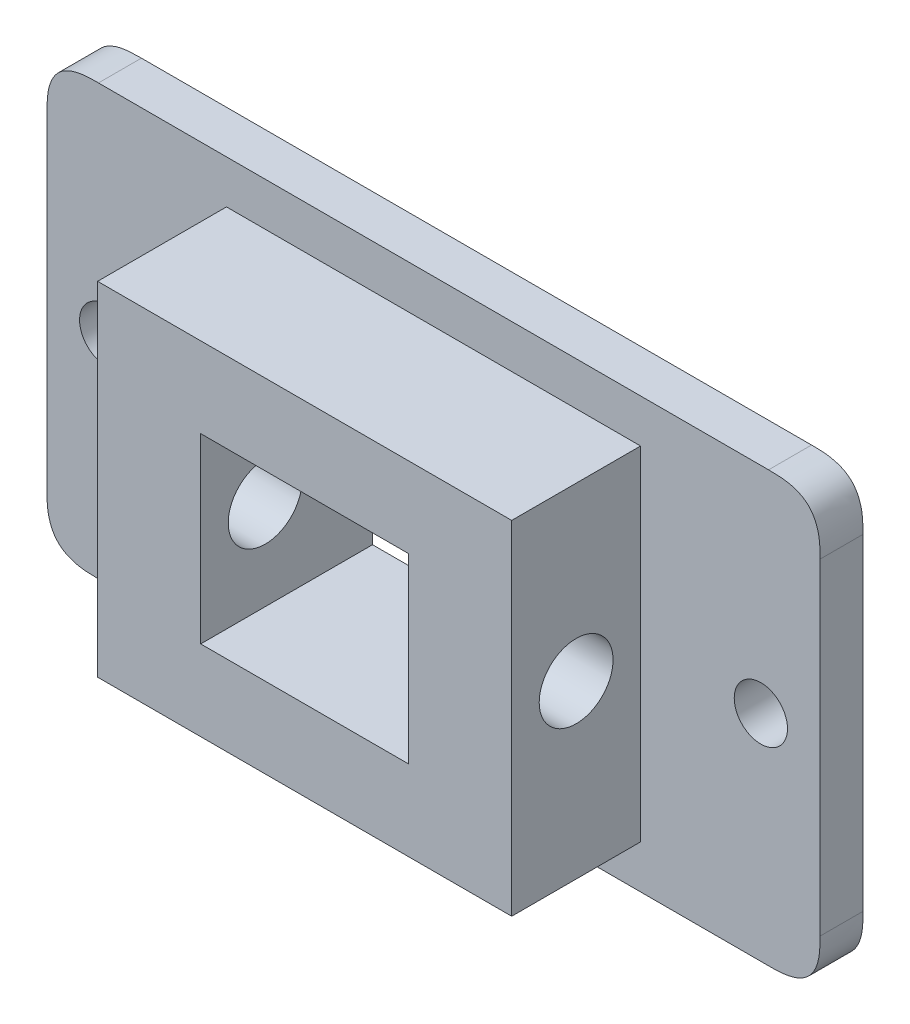
from build123d import *

# Parameters (mm, degrees)
SKETCH1_W           = 45
SKETCH1_H           = 25
SKETCH1_W_2         = 12.1
SKETCH1_H_2         = 10.6
BOSS_EXTRUDE1_DEPTH = 2.5
SKETCH2_W           = 12.1
SKETCH2_H           = 7.2
BOSS_EXTRUDE2_DEPTH = 7.5
BOSS_EXTRUDE3_START = 6.05
SKETCH3_W           = 7.5
SKETCH3_H           = 25
SKETCH3_R           = 2.15
BOSS_EXTRUDE3_DEPTH = 6
BOSS_EXTRUDE4_START = -14.05
SKETCH3_2_W         = 7.5
SKETCH3_2_H         = 25
SKETCH3_2_R         = 2.15
BOSS_EXTRUDE4_DEPTH = 8
SKETCH5_R           = 1.55
CUT_EXTRUDE1_DEPTH  = 10
FILLET1_SIZE        = 3
SKETCH6_OUTSIDE_W   = 57.488
SKETCH6_OUTSIDE_H   = 37.488
SKETCH6_OUTSIDE_W_2 = 24.1
SKETCH6_OUTSIDE_H_2 = 19.953815678
CUT_EXTRUDE2_DEPTH  = 7.5


with BuildPart() as part:
    # Sketch1 → Boss-Extrude1 (new body)
    with BuildSketch(Plane.XY):
        Rectangle(SKETCH1_W, SKETCH1_H)
        Rectangle(SKETCH1_W_2, SKETCH1_H_2, mode=Mode.SUBTRACT)
    extrude(amount=BOSS_EXTRUDE1_DEPTH)

    # Sketch2 → Boss-Extrude2 (add)
    with BuildSketch(Plane.XY.offset(2.5)):
        with Locations((0, -8.9)):
            Rectangle(SKETCH2_W, SKETCH2_H)
        with Locations((0, 8.9)):
            Rectangle(SKETCH2_W, SKETCH2_H)
    extrude(amount=BOSS_EXTRUDE2_DEPTH)

    # Sketch3 → Boss-Extrude3 (add)
    with BuildSketch(Plane(origin=(0, 0, 0), x_dir=(0, 0, -1), z_dir=(1, 0, 0)).offset(BOSS_EXTRUDE3_START)):
        with Locations((-6.25, 0)):
            Rectangle(SKETCH3_W, SKETCH3_H)
        with Locations(Location((-6.25, 0, 0), (0, 0, 180))):
            Circle(SKETCH3_R, mode=Mode.SUBTRACT)
    extrude(amount=BOSS_EXTRUDE3_DEPTH)

    # Sketch3<2> → Boss-Extrude4 (add)
    with BuildSketch(Plane(origin=(0, 0, 0), x_dir=(0, 0, -1), z_dir=(1, 0, 0)).offset(BOSS_EXTRUDE4_START)):
        with Locations((-6.25, 0)):
            Rectangle(SKETCH3_2_W, SKETCH3_2_H)
        with Locations(Location((-6.25, 0, 0), (0, 0, 180))):
            Circle(SKETCH3_2_R, mode=Mode.SUBTRACT)
    extrude(amount=BOSS_EXTRUDE4_DEPTH)

    # Sketch5 → Cut-Extrude1 (cut)
    with BuildSketch(Plane(origin=(0, 0, 0), x_dir=(-1, 0, 0), z_dir=(0, 0, -1))):
        with Locations((-19.05, 0)):
            Circle(SKETCH5_R)
        with Locations(Location((19.05, 0, 0), (0, 0, 180))):
            Circle(SKETCH5_R)
    extrude(amount=-CUT_EXTRUDE1_DEPTH, mode=Mode.SUBTRACT)

    # Fillet1
    # a fillet whose section is not a circle: 3 mm, written as the material it takes off along each edge
    with BuildSketch(Plane(origin=(-22.5, -12.5, -7.5), x_dir=(0, 1, 0), z_dir=(0, 0, 1)), Plane(origin=(-22.5, 12.5, -7.5), x_dir=(1, 0, 0), z_dir=(0, 0, 1))) as fillet1_piece_1:
        with BuildLine():
            add(Edge.make_bspline([(FILLET1_SIZE, 0), (FILLET1_SIZE * 0.831801948466, 0), (FILLET1_SIZE * 0.663603896932, 0), (FILLET1_SIZE * 0.292893218813, -FILLET1_SIZE * 0.0716919198361), (FILLET1_SIZE * 0.0716919198361, -FILLET1_SIZE * 0.292893218813), (0, -FILLET1_SIZE * 0.663603896932), (0, -FILLET1_SIZE * 0.831801948466), (0, -FILLET1_SIZE)], knots=[0, 0, 0, 0, 0, 0, 0.5, 0.5, 1, 1, 1, 1, 1, 1], degree=5))
            Line((0, -FILLET1_SIZE), (0, 0))
            Line((0, 0), (FILLET1_SIZE, 0))
        make_face()
    extrude(amount=17.5, mode=Mode.SUBTRACT)
    with BuildSketch(Plane(origin=(22.5, -12.5, -7.5), x_dir=(0, 1, 0), z_dir=(0, 0, 1)), Plane(origin=(22.5, 12.5, -7.5), x_dir=(-1, 0, 0), z_dir=(0, 0, 1))) as fillet1_piece_2:
        with BuildLine():
            add(Edge.make_bspline([(FILLET1_SIZE, 0), (FILLET1_SIZE * 0.831801948466, 0), (FILLET1_SIZE * 0.663603896932, 0), (FILLET1_SIZE * 0.292893218813, FILLET1_SIZE * 0.0716919198361), (FILLET1_SIZE * 0.0716919198361, FILLET1_SIZE * 0.292893218813), (0, FILLET1_SIZE * 0.663603896932), (0, FILLET1_SIZE * 0.831801948466), (0, FILLET1_SIZE)], knots=[0, 0, 0, 0, 0, 0, 0.5, 0.5, 1, 1, 1, 1, 1, 1], degree=5))
            Line((0, FILLET1_SIZE), (0, 0))
            Line((0, 0), (FILLET1_SIZE, 0))
        make_face()
    extrude(amount=17.5, mode=Mode.SUBTRACT)

    # Sketch6 outside → Cut-Extrude2 (cut)
    with BuildSketch(Plane.XY.offset(10)):
        Rectangle(SKETCH6_OUTSIDE_W, SKETCH6_OUTSIDE_H)
        Rectangle(SKETCH6_OUTSIDE_W_2, SKETCH6_OUTSIDE_H_2, mode=Mode.SUBTRACT)
    extrude(amount=-CUT_EXTRUDE2_DEPTH, mode=Mode.SUBTRACT)


solid = part.part
